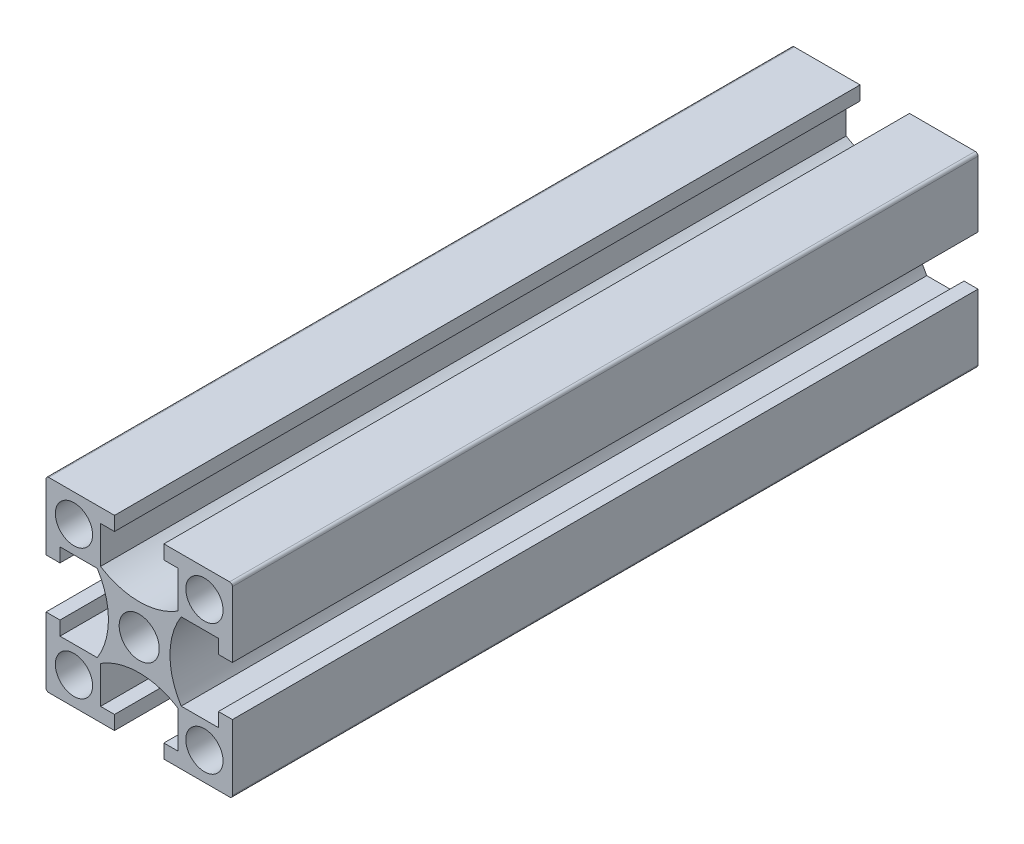
from build123d import *

# Parameters (mm, degrees)
SKETCH_1_W               = 20
SKETCH_1_H               = 20
SKETCH_1_R               = 2
SKETCH_1_R_2             = 2.15
EXTRUDE_1_DEPTH          = 80
CUT_EXTRUDE_1_REACH      = 83.24
PATTERN_CIRCULAR_1_COUNT = 4
FILLET_1_R               = 0.3


with BuildPart() as part:
    # 스케치1 → 보스-돌출1 (new body)
    with BuildSketch(Plane.XY):
        Rectangle(SKETCH_1_W, SKETCH_1_H)
        with Locations((-7, -7)):
            Circle(SKETCH_1_R, mode=Mode.SUBTRACT)
        with Locations((7, -7)):
            Circle(SKETCH_1_R, mode=Mode.SUBTRACT)
        with Locations((-7, 7)):
            Circle(SKETCH_1_R, mode=Mode.SUBTRACT)
        Circle(SKETCH_1_R_2, mode=Mode.SUBTRACT)
        with Locations((7, 7)):
            Circle(SKETCH_1_R, mode=Mode.SUBTRACT)
    extrude(amount=EXTRUDE_1_DEPTH)

    # 스케치1<3> → 컷-돌출1 (cut, up to next)
    with BuildSketch(Plane.XY, mode=Mode.PRIVATE) as cut_extrude_1_sk1:
        with BuildLine():
            Line((-8.5, 2.65), (-10, 2.65))
            Line((-10, 2.65), (-10, -2.65))
            Line((-10, -2.65), (-8.5, -2.65))
            Line((-8.5, -2.65), (-8.5, -4.15))
            Line((-8.5, -4.15), (-4.503166667, -4.15))
            ThreePointArc((-4.503166667, -4.15), (-3.3, 0), (-4.503166667, 4.15))
            Line((-4.503166667, 4.15), (-8.5, 4.15))
            Line((-8.5, 4.15), (-8.5, 2.65))
        make_face()
    cut_extrude_1_tool1 = extrude(cut_extrude_1_sk1.sketch, amount=CUT_EXTRUDE_1_REACH, mode=Mode.PRIVATE) & part.part
    cut_extrude_1 = cut_extrude_1_tool1.solids().sort_by_distance((-6.606913, 0, 0))[0]
    add(cut_extrude_1, mode=Mode.SUBTRACT)

    # 원형 패턴1: 컷-돌출1 ×4 about axis
    pattern_circular_1_axis = Axis((0, 0, 80), (0, 0, -1))
    for i in range(1, PATTERN_CIRCULAR_1_COUNT):
        add(cut_extrude_1.rotate(pattern_circular_1_axis, i * 360 / PATTERN_CIRCULAR_1_COUNT), mode=Mode.SUBTRACT)

    # 필렛1
    fillet_1_edges = [part.edges().sort_by_distance(p)[0] for p in [
        (10, -10, 40),
        (-10, -10, 40),
        (-10, 10, 40),
        (10, 10, 40),
    ]]
    fillet(fillet_1_edges, radius=FILLET_1_R)


solid = part.part
